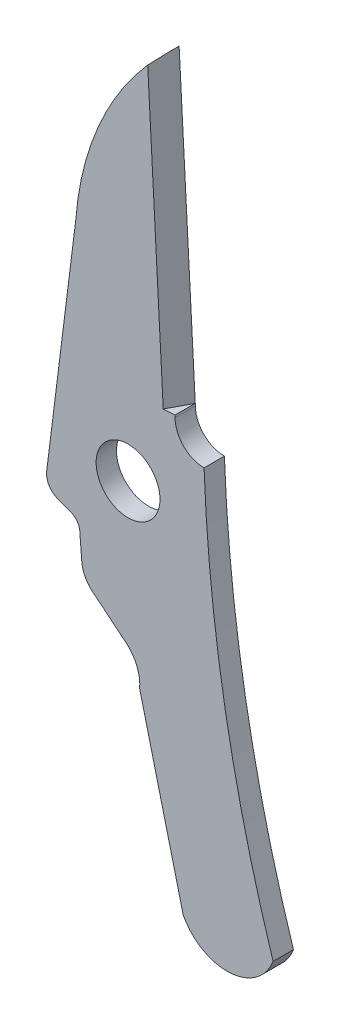
from build123d import *

# Parameters (mm, degrees)
SKETCH1_R           = 1.397
BOSS_EXTRUDE1_DEPTH = 0.4445
CUT_EXTRUDE4_DEPTH  = 16.51


with BuildPart() as part:
    # Sketch1 → Boss-Extrude1 (new, symmetric)
    with BuildSketch(Plane.XY):
        with BuildLine():
            Line((8.850150751, 21.403957252), (9.561350751, 8.119757252))
            ThreePointArc((9.561350751, 8.119757252), (9.933325139, 7.221731639), (10.831350751, 6.849757252))
            ThreePointArc((10.831350751, 6.849757252), (11.755937604, -1.851272533), (13.853950751, -10.346042748))
            ThreePointArc((13.853950751, -10.346042748), (11.951330059, -11.724054337), (9.916950751, -10.549242748))
            Line((9.916950751, -10.549242748), (8.011950751, -2.929242748))
            ThreePointArc((8.011950751, -2.929242748), (7.848805495, -2.036429163), (7.249950751, -1.354442748))
            Line((7.249950751, -1.354442748), (6.081550751, -0.389242748))
            ThreePointArc((6.081550751, -0.389242748), (5.645003037, 0.083323643), (5.471950751, 0.702957252))
            Line((5.471950751, 0.702957252), (5.395750751, 1.668157252))
            ThreePointArc((5.395750751, 1.668157252), (5.244706256, 2.082807876), (4.862350751, 2.303157252))
            Line((4.862350751, 2.303157252), (4.405150751, 2.480957252))
            ThreePointArc((4.405150751, 2.480957252), (4.028994258, 2.819571892), (3.947950751, 3.319157252))
            Line((3.947950751, 3.319157252), (5.217950751, 13.453757252))
            ThreePointArc((5.217950751, 13.453757252), (6.32855291, 17.751177352), (8.850150751, 21.403957252))
        make_face()
        with Locations((7.503950751, 4.690757252)):
            Circle(SKETCH1_R, mode=Mode.SUBTRACT)
    extrude(amount=BOSS_EXTRUDE1_DEPTH, both=True)

    # Sketch2 → Cut-Extrude4 (cut)
    with BuildSketch(Plane(origin=(-1.293745537, 24.165318418, 0), x_dir=(0.9985699529742528, 0.05346072405980692, 0), z_dir=(-0.05346072405980692, 0.9985699529742528, 0))):
        Polygon((9.981765672, 0.4445), (9.981765672, -0.4445), (9.468501283, -0.4445), align=None)
    extrude(amount=-CUT_EXTRUDE4_DEPTH, mode=Mode.SUBTRACT)


solid = part.part
